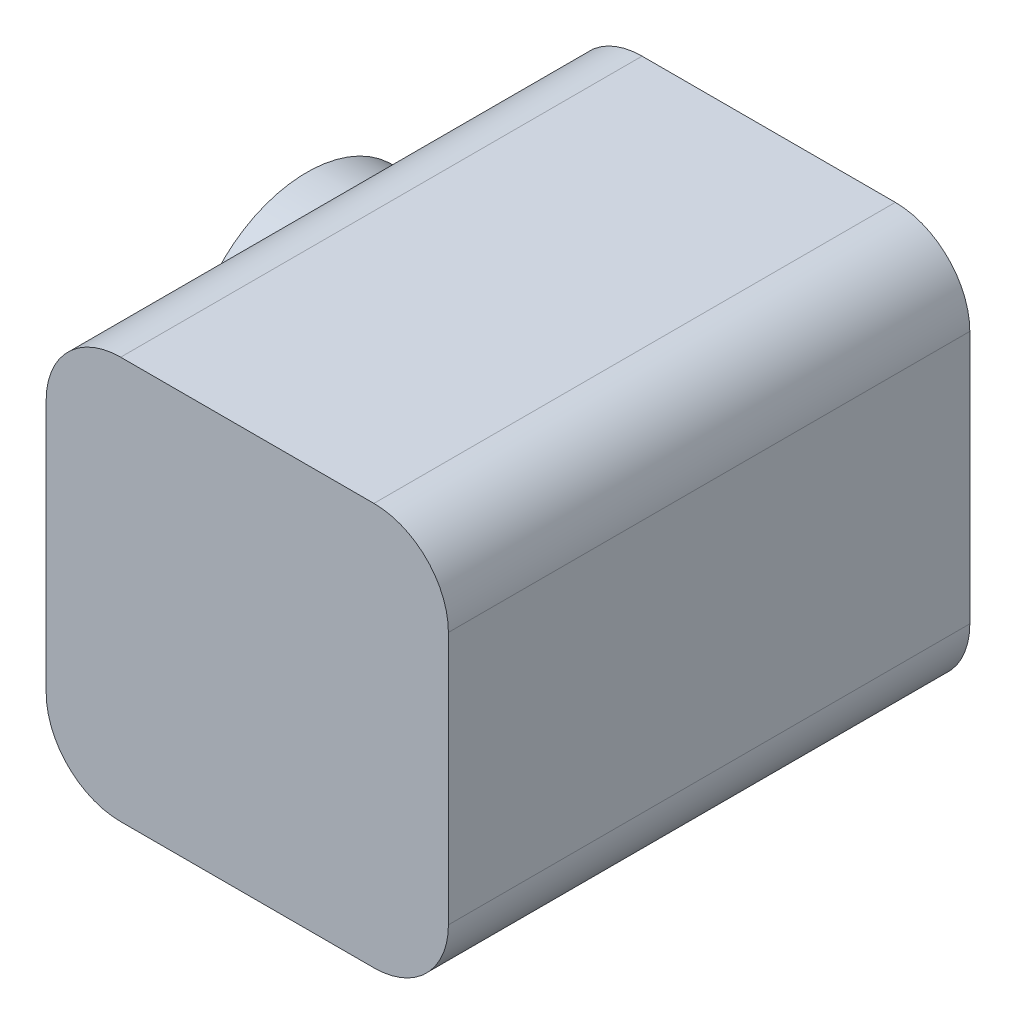
from build123d import *

# Parameters (mm, degrees)
BOSS_EXTRU_5_DEPTH = 25
ESQUISSE7_R        = 8
ESQUISSE7_R_2      = 7.5
BOSS_EXTRU_7_DEPTH = 5
BOSS_EXTRU_6_DEPTH = 10


# Read off the part's stored shape, not the designer's step: Boss.-Extru.5
with BuildPart() as part:
    # Boss.-Extru.5 outline → Boss.-Extru.5 (new body)
    # profile 1 of 2: a face of its own
    with BuildSketch(Plane.XY):
        with BuildLine():
            Line((-8.5, -13.5), (8.5, -13.5))
            ThreePointArc((8.5, -13.5), (12.035533906, -12.035533906), (13.5, -8.5))
            Line((13.5, -8.5), (13.5, 8.5))
            ThreePointArc((13.5, 8.5), (12.035533906, 12.035533906), (8.5, 13.5))
            Line((8.5, 13.5), (-8.5, 13.5))
            ThreePointArc((-8.5, 13.5), (-12.035533906, 12.035533906), (-13.5, 8.5))
            Line((-13.5, 8.5), (-13.5, -8.5))
            ThreePointArc((-13.5, -8.5), (-12.035533906, -12.035533906), (-8.5, -13.5))
        make_face()
        with BuildLine():
            Line((-10, 3.5), (-10, 8.5))
            ThreePointArc((-10, 8.5), (-9.560660172, 9.560660172), (-8.5, 10))
            Line((-8.5, 10), (-3.5, 10))
            Line((-3.5, 10), (-3.5, 9.5))
            Line((-3.5, 9.5), (-3, 9.5))
            Line((-3, 9.5), (-3, 8.5))
            Line((-3, 8.5), (-6, 8.5))
            Line((-6, 8.5), (-6, 7.060660172))
            Line((-6, 7.060660172), (-3.439339828, 4.5))
            Line((-3.439339828, 4.5), (-0.866025404, 4.5))
            Line((-0.866025404, 4.5), (0, 4))
            Line((0, 4), (0.866025404, 4.5))
            Line((0.866025404, 4.5), (3.439339828, 4.5))
            Line((3.439339828, 4.5), (6, 7.060660172))
            Line((6, 7.060660172), (6, 8.5))
            Line((6, 8.5), (3, 8.5))
            Line((3, 8.5), (3, 9.5))
            Line((3, 9.5), (3.5, 9.5))
            Line((3.5, 9.5), (3.5, 10))
            Line((3.5, 10), (8.5, 10))
            ThreePointArc((8.5, 10), (9.560660172, 9.560660172), (10, 8.5))
            Line((10, 8.5), (10, 3.5))
            Line((10, 3.5), (9.5, 3.5))
            Line((9.5, 3.5), (9.5, 3))
            Line((9.5, 3), (8.5, 3))
            Line((8.5, 3), (8.5, 6))
            Line((8.5, 6), (7.060660172, 6))
            Line((7.060660172, 6), (4.5, 3.439339828))
            Line((4.5, 3.439339828), (4.5, 0.866025404))
            Line((4.5, 0.866025404), (4, 0))
            Line((4, 0), (4.5, -0.866025404))
            Line((4.5, -0.866025404), (4.5, -3.439339828))
            Line((4.5, -3.439339828), (7.060660172, -6))
            Line((7.060660172, -6), (8.5, -6))
            Line((8.5, -6), (8.5, -3))
            Line((8.5, -3), (9.5, -3))
            Line((9.5, -3), (9.5, -3.5))
            Line((9.5, -3.5), (10, -3.5))
            Line((10, -3.5), (10, -8.5))
            ThreePointArc((10, -8.5), (9.560660172, -9.560660172), (8.5, -10))
            Line((8.5, -10), (3.5, -10))
            Line((3.5, -10), (3.5, -9.5))
            Line((3.5, -9.5), (3, -9.5))
            Line((3, -9.5), (3, -8.5))
            Line((3, -8.5), (6, -8.5))
            Line((6, -8.5), (6, -7.060660172))
            Line((6, -7.060660172), (3.439339828, -4.5))
            Line((3.439339828, -4.5), (0.866025404, -4.5))
            Line((0.866025404, -4.5), (0, -4))
            Line((0, -4), (-0.866025404, -4.5))
            Line((-0.866025404, -4.5), (-3.439339828, -4.5))
            Line((-3.439339828, -4.5), (-6, -7.060660172))
            Line((-6, -7.060660172), (-6, -8.5))
            Line((-6, -8.5), (-3, -8.5))
            Line((-3, -8.5), (-3, -9.5))
            Line((-3, -9.5), (-3.5, -9.5))
            Line((-3.5, -9.5), (-3.5, -10))
            Line((-3.5, -10), (-8.5, -10))
            ThreePointArc((-8.5, -10), (-9.560660172, -9.560660172), (-10, -8.5))
            Line((-10, -8.5), (-10, -3.5))
            Line((-10, -3.5), (-9.5, -3.5))
            Line((-9.5, -3.5), (-9.5, -3))
            Line((-9.5, -3), (-8.5, -3))
            Line((-8.5, -3), (-8.5, -6))
            Line((-8.5, -6), (-7.060660172, -6))
            Line((-7.060660172, -6), (-4.5, -3.439339828))
            Line((-4.5, -3.439339828), (-4.5, -0.866025404))
            Line((-4.5, -0.866025404), (-4, 0))
            Line((-4, 0), (-4.5, 0.866025404))
            Line((-4.5, 0.866025404), (-4.5, 3.439339828))
            Line((-4.5, 3.439339828), (-7.060660172, 6))
            Line((-7.060660172, 6), (-8.5, 6))
            Line((-8.5, 6), (-8.5, 3))
            Line((-8.5, 3), (-9.5, 3))
            Line((-9.5, 3), (-9.5, 3.5))
            Line((-9.5, 3.5), (-10, 3.5))
        make_face(mode=Mode.SUBTRACT)
    # profile 2 of 2: a face of its own
    with BuildSketch(Plane.XY):
        with BuildLine():
            Line((1.949592103, 3.000876196), (1.276279893, 2.435900169))
            ThreePointArc((1.276279893, 2.435900169), (0.001756003, 2.749999439), (-1.273167982, 2.43752811))
            Line((-1.273167982, 2.43752811), (-1.947287092, 3.003181207))
            Line((-1.947287092, 3.003181207), (-3.000876196, 1.949592103))
            Line((-3.000876196, 1.949592103), (-2.435900169, 1.276279893))
            ThreePointArc((-2.435900169, 1.276279893), (-2.749999439, 0.001756003), (-2.43752811, -1.273167982))
            Line((-2.43752811, -1.273167982), (-3.003181207, -1.947287092))
            Line((-3.003181207, -1.947287092), (-1.949592103, -3.000876196))
            Line((-1.949592103, -3.000876196), (-1.276279893, -2.435900169))
            ThreePointArc((-1.276279893, -2.435900169), (-0.001756003, -2.749999439), (1.273167982, -2.43752811))
            Line((1.273167982, -2.43752811), (1.947287092, -3.003181207))
            Line((1.947287092, -3.003181207), (3.000876196, -1.949592103))
            Line((3.000876196, -1.949592103), (2.435900169, -1.276279893))
            ThreePointArc((2.435900169, -1.276279893), (2.749999439, -0.001756003), (2.43752811, 1.273167982))
            Line((2.43752811, 1.273167982), (3.003181207, 1.947287092))
            Line((3.003181207, 1.947287092), (1.949592103, 3.000876196))
        make_face()
    extrude(amount=BOSS_EXTRU_5_DEPTH)

    # Esquisse7 → Boss.-Extru.7 (add)
    with BuildSketch(Plane.ZY.offset(13.5)):
        with Locations(Location((12.5, 0, 0), (0, 0, 180))):
            Circle(ESQUISSE7_R)
        with Locations((12.5, 0)):
            Circle(ESQUISSE7_R_2, mode=Mode.SUBTRACT)
    extrude(amount=BOSS_EXTRU_7_DEPTH)

    # Esquisse6 → Boss.-Extru.6 (add)
    with BuildSketch(Plane.XY.offset(25)):
        with BuildLine():
            Line((-13.5, 8.5), (-13.5, -8.5))
            ThreePointArc((-13.5, -8.5), (-12.035533906, -12.035533906), (-8.5, -13.5))
            Line((-8.5, -13.5), (8.5, -13.5))
            ThreePointArc((8.5, -13.5), (12.035533906, -12.035533906), (13.5, -8.5))
            Line((13.5, -8.5), (13.5, 8.5))
            ThreePointArc((13.5, 8.5), (12.035533906, 12.035533906), (8.5, 13.5))
            Line((8.5, 13.5), (-8.5, 13.5))
            ThreePointArc((-8.5, 13.5), (-12.035533906, 12.035533906), (-13.5, 8.5))
        make_face()
    extrude(amount=BOSS_EXTRU_6_DEPTH)


solid = part.part
